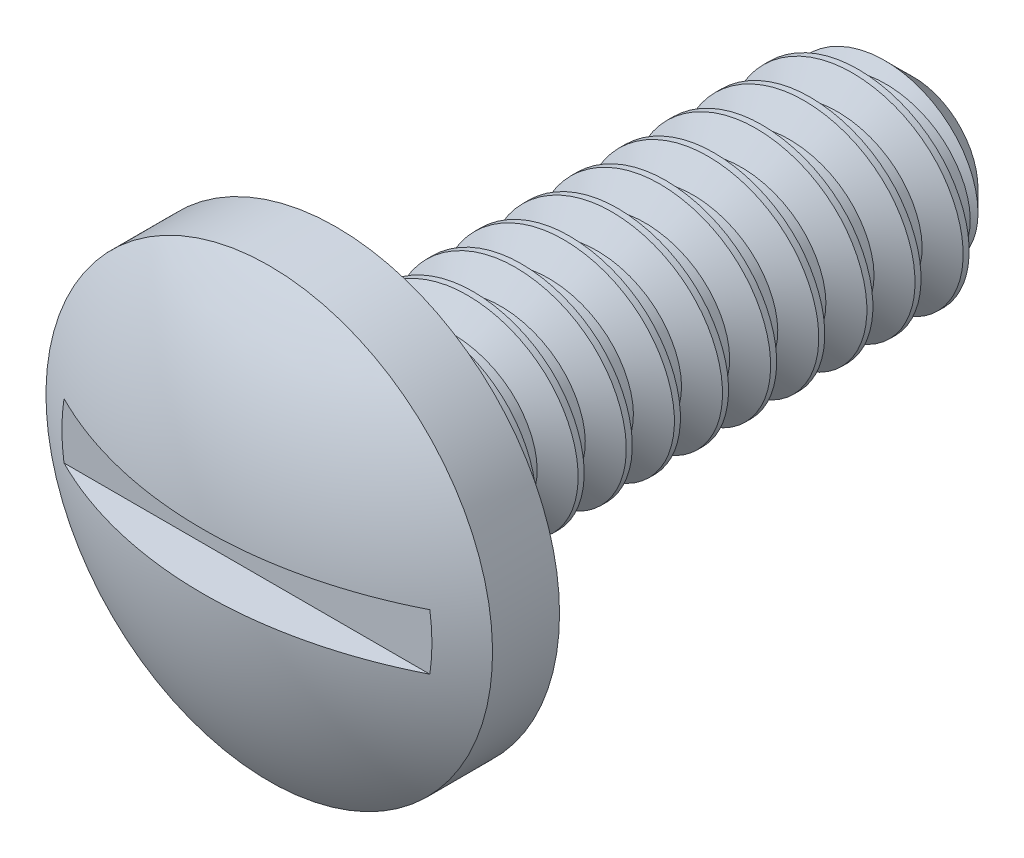
from build123d import *

# Parameters (mm, degrees)
SKETCH1_R           = 3.683
EXTRUDE3_DEPTH      = 2.2098
SKETCH18_W          = 9.525
SKETCH18_H          = 1.32297021
SWEEP1_PITCH        = 0.79375
LPATTERN3_COUNT     = 11
LPATTERN3_PITCH     = 0.79375
LPATTERN3_COL_COUNT = 2
LPATTERN3_COL_PITCH = 0.79375
SKETCH12_W          = 7.366
SKETCH12_H          = 0.92075
CUT_EXTRUDE1_DEPTH  = 0.7366


with BuildPart() as part:
    # Sketch1 → Extrude3 (new body)
    with BuildSketch(Plane.XY):
        Circle(SKETCH1_R)
    extrude(amount=EXTRUDE3_DEPTH)

    # Sketch11 → Cut-Revolve3 (revolve, cut)
    with BuildSketch(Plane(origin=(0, 0, 0), x_dir=(0, 0, -1), z_dir=(1, 0, 0))):
        with BuildLine():
            Line((-1.1049, 3.937), (-1.1049, 3.683))
            ThreePointArc((-1.1049, 3.683), (-1.927624812, 1.922582444), (-2.2098, 0))
            Line((-2.2098, 0), (-2.4638, 0))
            Line((-2.4638, 0), (-2.4638, 3.937))
            Line((-2.4638, 3.937), (-1.1049, 3.937))
        make_face()
    revolve(axis=Axis((0, 0, 0), (0, 0, 1)), mode=Mode.SUBTRACT)

    # Sketch18 → Revolve1 (revolve)
    with BuildSketch(Plane(origin=(0, 0, 0), x_dir=(0, 0, -1), z_dir=(1, 0, 0))):
        with Locations((4.7625, 0.661485105)):
            Rectangle(SKETCH18_W, SKETCH18_H)
    revolve(axis=Axis((0, 0, 0), (0, 0, 1)))

    # Sweep1: the profile of Sketch14 profile screwed along a right-hand helix of 1.5 turns, 6 arcs to a turn; built about Z, then put on its axis
    sweep1_z = Axis((0, 0, 0), (0, 0, 1))
    sweep1_corners = [(1.7526, 0, -0.049609375), (1.7526, 0, 0.049609375), (1.32267021, 0, 0.297829455), (1.32267021, 0, -0.297829455)]
    with BuildLine(mode=Mode.PRIVATE) as sweep1_profile:
        Line(sweep1_corners[0], sweep1_corners[1])
        Line(sweep1_corners[1], sweep1_corners[2])
        Line(sweep1_corners[2], sweep1_corners[3])
        Line(sweep1_corners[3], sweep1_corners[0])
    sweep1_cap = Face(sweep1_profile.wire())
    sweep1_turn_angles = [0, 30, 60, 90, 120, 150, 180, 210, 240, 270, 300, 330, 360]
    sweep1_turn_weights = [1, 0.8660254037844387, 1, 0.8660254037844387, 1, 0.8660254037844387, 1, 0.8660254037844387, 1, 0.8660254037844387, 1, 0.8660254037844387, 1]
    sweep1_turn_rails = [Edge.make_bspline([Vector(p[0], p[1], 0).rotate(sweep1_z, sweep1_turn_angles[k]) / sweep1_turn_weights[k] + Vector(0, 0, p[2] + SWEEP1_PITCH * sweep1_turn_angles[k] / 360) for k in range(13)], [0, 0, 0, 1, 1, 2, 2, 3, 3, 4, 4, 5, 5, 6, 6, 6], 2, sweep1_turn_weights) for p in sweep1_corners]
    sweep1_turn_sides = [Face.make_surface_from_curves(sweep1_turn_rails[p[0]], sweep1_turn_rails[p[1]]) for p in [(0, 1), (1, 2), (2, 3), (3, 0)]]
    sweep1_last_angles = [360, 390, 420, 450, 480, 510, 540]
    sweep1_last_weights = [1, 0.8660254037844387, 1, 0.8660254037844387, 1, 0.8660254037844337, 1]
    sweep1_last_rails = [Edge.make_bspline([Vector(p[0], p[1], 0).rotate(sweep1_z, sweep1_last_angles[k]) / sweep1_last_weights[k] + Vector(0, 0, p[2] + SWEEP1_PITCH * sweep1_last_angles[k] / 360) for k in range(7)], [0, 0, 0, 1, 1, 2, 2, 3, 3, 3], 2, sweep1_last_weights) for p in sweep1_corners]
    sweep1_last_sides = [Face.make_surface_from_curves(sweep1_last_rails[p[0]], sweep1_last_rails[p[1]]) for p in [(0, 1), (1, 2), (2, 3), (3, 0)]]
    sweep1 = Plane(origin=(0, 0, -0.49609375), x_dir=(0, 1, 0), z_dir=(0, 0, -1)) * Solid(Shell([*sweep1_turn_sides, *sweep1_last_sides, sweep1_cap, sweep1_cap.rotate(sweep1_z, 540).moved(Location((0, 0, SWEEP1_PITCH * 540 / 360)))]))
    add(sweep1)

    # LPattern3: Sweep1 ×11
    with Locations(*[(0, 0, -i * LPATTERN3_PITCH) for i in range(1, LPATTERN3_COUNT)]):
        add(sweep1)

    # LPattern3 col: Sweep1 ×2
    with Locations(*[(0, 0, i * LPATTERN3_COL_PITCH) for i in range(1, LPATTERN3_COL_COUNT)]):
        add(sweep1)

    # Sketch13 → Cut-Revolve4 (revolve, cut)
    with BuildSketch(Plane(origin=(0, 0, 0), x_dir=(0, 0, -1), z_dir=(1, 0, 0))):
        Polygon((9.525, 1.06008021), (8.83248021, 1.7526), (9.525, 1.7526), (12.065, 1.7526), (12.065, 1.06008021), align=None)
    revolve(axis=Axis((0, 0, 0), (0, 0, -1)), mode=Mode.SUBTRACT)

    # Sketch12 → Cut-Extrude1 (cut)
    with BuildSketch(Plane.XY.offset(2.2098)):
        Rectangle(SKETCH12_W, SKETCH12_H)
    extrude(amount=-CUT_EXTRUDE1_DEPTH, mode=Mode.SUBTRACT)


solid = part.part
